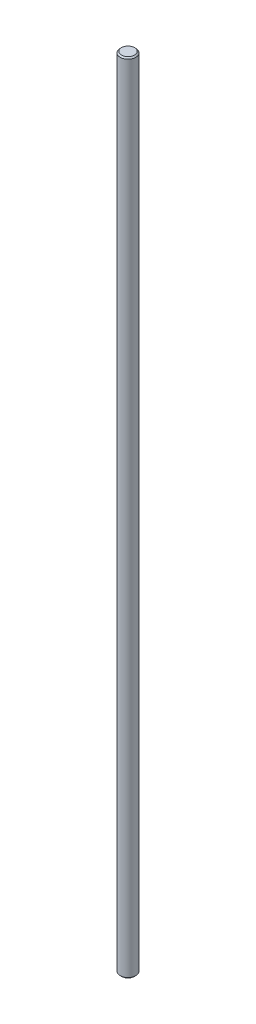
from build123d import *

# Parameters (mm, degrees)
SKETCH1_R           = 3
BOSS_EXTRUDE1_DEPTH = 306
CHAMFER1_SIZE       = 0.5
CHAMFER2_SIZE       = 0.5


with BuildPart() as part:
    # Sketch1 → Boss-Extrude1 (new body)
    with BuildSketch(Plane(origin=(0, 0, 0), x_dir=(1, 0, 0), z_dir=(0, 1, 0))):
        Circle(SKETCH1_R)
    extrude(amount=BOSS_EXTRUDE1_DEPTH)

    # Chamfer1
    chamfer1_edges = [part.edges().sort_by_distance(p)[0] for p in [
        (-3, 0, 0),
    ]]
    chamfer(chamfer1_edges, length=CHAMFER1_SIZE)

    # Chamfer2
    chamfer2_edges = [part.edges().sort_by_distance(p)[0] for p in [
        (-3, 306, 0),
    ]]
    chamfer(chamfer2_edges, length=CHAMFER2_SIZE)


solid = part.part
